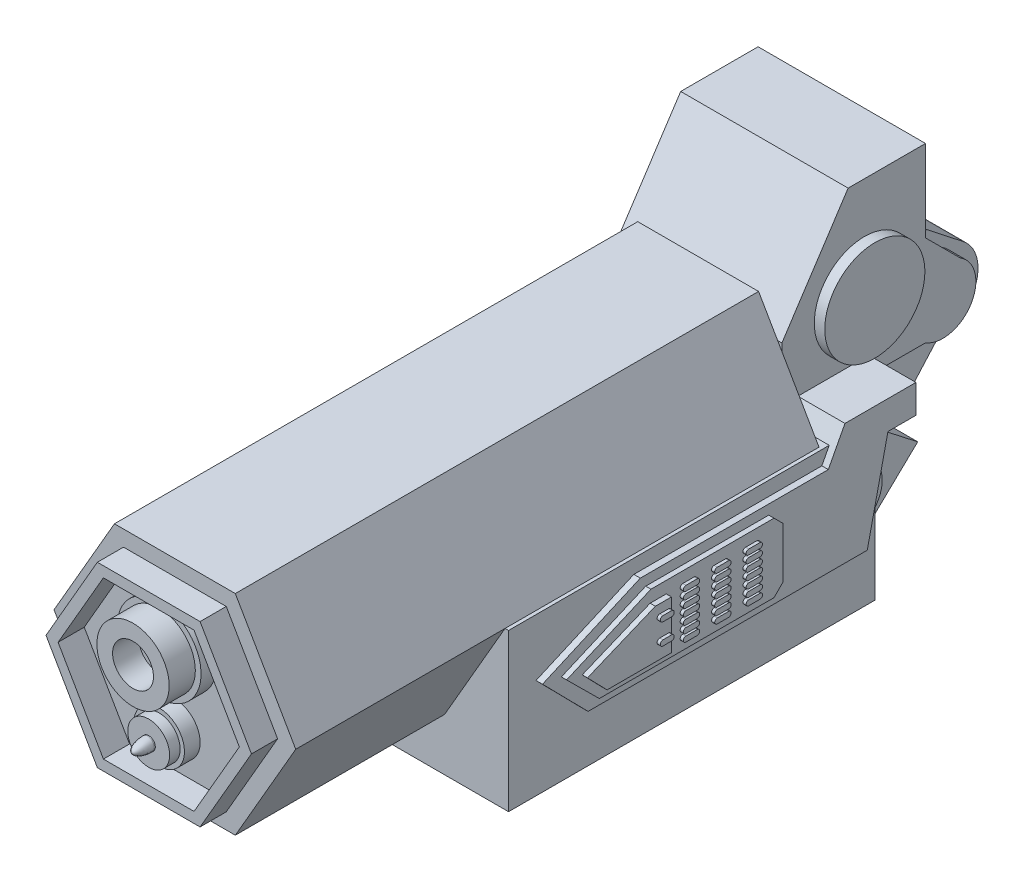
from build123d import *

# Parameters (mm, degrees)
BOSS_EXTRUDE1_DEPTH       = 127
EXTRUDE_THIN1_DEPTH       = 6.35
SKETCH3_R                 = 10.16
SKETCH3_R_2               = 6.130982387
BOSS_EXTRUDE2_DEPTH       = 3.81
SKETCH4_R                 = 8.771014966
SKETCH4_R_2               = 4.961014966
EXTRUDE_THIN2_DEPTH       = 6.35
SKETCH5_R                 = 5.08
BOSS_EXTRUDE3_DEPTH       = 2.54
SKETCH6_R                 = 1.599592482
BOSS_EXTRUDE4_DEPTH       = 0.254
DOME2_FACE_RADIUS         = 1.599592482
DOME2_HEIGHT              = 3.81
BOSS_EXTRUDE5_START       = -50.8
SKETCH7_W                 = 60.53039592
SKETCH7_H                 = 38.1
BOSS_EXTRUDE5_DEPTH       = 88.9
BOSS_EXTRUDE6_DEPTH       = 15.875
BOSS_EXTRUDE6_DEPTH_BACK  = 15.875
BOSS_EXTRUDE7_DEPTH       = 20.32
BOSS_EXTRUDE7_DEPTH_BACK  = 20.32
BOSS_EXTRUDE8_DEPTH       = 22.86
BOSS_EXTRUDE8_DEPTH_BACK  = 22.86
SKETCH10_R                = 12.155896329
BOSS_EXTRUDE9_DEPTH       = 12.7
BOSS_EXTRUDE9_DEPTH_BACK  = 12.7
BOSS_EXTRUDE10_DEPTH      = 15.24
BOSS_EXTRUDE10_DEPTH_BACK = 15.24
SKETCH12_R                = 7.651057211
BOSS_EXTRUDE11_DEPTH      = 1.27
BOSS_EXTRUDE12_DEPTH      = 2.54
FILLET1_R                 = 1.27
BOSS_EXTRUDE13_DEPTH      = 31.75
BOSS_EXTRUDE13_DEPTH_BACK = 31.75
BOSS_EXTRUDE14_DEPTH      = 1.27
BOSS_EXTRUDE15_DEPTH      = 1.27
BOSS_EXTRUDE16_DEPTH      = 0.762
BOSS_EXTRUDE17_DEPTH      = 0.762


with BuildPart() as part:
    # Sketch1 → Boss-Extrude1 (new body)
    with BuildSketch(Plane.XY):
        Polygon((14.664696837, 25.4), (-14.664696837, 25.4), (-29.329393675, 0), (-14.664696837, -25.4), (14.664696837, -25.4), (29.329393675, 0), align=None)
    extrude(amount=-BOSS_EXTRUDE1_DEPTH)

    # Sketch2 → Extrude-Thin1 (add)
    with BuildSketch(Plane.XY):
        Polygon((12.464992312, 21.59), (-12.464992312, 21.59), (-24.929984624, 0), (-12.464992312, -21.59), (12.464992312, -21.59), (24.929984624, 0), align=None)
        Polygon((10.998522628, 19.05), (-10.998522628, 19.05), (-21.997045256, 0), (-10.998522628, -19.05), (10.998522628, -19.05), (21.997045256, 0), align=None, mode=Mode.SUBTRACT)
    extrude(amount=EXTRUDE_THIN1_DEPTH)

    # Sketch3 → Boss-Extrude2 (add)
    with BuildSketch(Plane.XY):
        with Locations((0, 8.153143798)):
            Circle(SKETCH3_R)
        with Locations((0, -10.205567617)):
            Circle(SKETCH3_R_2)
    extrude(amount=BOSS_EXTRUDE2_DEPTH)

    # Sketch4 → Extrude-Thin2 (add)
    with BuildSketch(Plane.XY.offset(3.81)):
        with Locations((0, 8.153143798)):
            Circle(SKETCH4_R)
        with Locations((0, 8.153143798)):
            Circle(SKETCH4_R_2, mode=Mode.SUBTRACT)
    extrude(amount=EXTRUDE_THIN2_DEPTH)

    # Sketch5 → Boss-Extrude3 (add)
    with BuildSketch(Plane.XY.offset(3.81)):
        with Locations((0, -10.205567617)):
            Circle(SKETCH5_R)
    extrude(amount=BOSS_EXTRUDE3_DEPTH)

    # Sketch6 → Boss-Extrude4 (add)
    with BuildSketch(Plane.XY.offset(6.35)):
        with Locations((0, -10.205567617)):
            Circle(SKETCH6_R)
    extrude(amount=BOSS_EXTRUDE4_DEPTH)

    # Dome2: an elliptical dome of height H over a round flat face of radius A is half a spheroid: the quarter ellipse of half axes A and H revolved about the face's axis
    with BuildSketch(Plane((0, -10.205567617, 6.604), x_dir=(0, 1, 0), z_dir=(1, 0, 0)), mode=Mode.PRIVATE) as dome2_quarter:
        Ellipse(DOME2_FACE_RADIUS, DOME2_HEIGHT)
        Rectangle(DOME2_FACE_RADIUS, DOME2_HEIGHT, align=(Align.MIN, Align.MIN), mode=Mode.INTERSECT)
    revolve(dome2_quarter.sketch, axis=Axis((0, -10.205567617, 6.604), (0, 0, 1)))

    # Sketch7 → Boss-Extrude5 (add)
    with BuildSketch(Plane.XY.offset(BOSS_EXTRUDE5_START)):
        with Locations((-0.084337319, -19.05)):
            Rectangle(SKETCH7_W, SKETCH7_H)
    extrude(amount=-BOSS_EXTRUDE5_DEPTH)

    # Sketch8 → Boss-Extrude6 (add, two sides: drawn at the far end of the back side and taken through both)
    with BuildSketch(Plane(origin=(0, 0, 0), x_dir=(0, 0, -1), z_dir=(1, 0, 0)).offset(-BOSS_EXTRUDE6_DEPTH_BACK)):
        with BuildLine():
            Line((139.7, -19.05), (156.755020483, -19.05))
            Line((156.755020483, -19.05), (169.665919001, -4.499127949))
            ThreePointArc((169.665919001, -4.499127949), (178.53263058, 1.818354273), (175.456736667, 12.261918439))
            Line((175.456736667, 12.261918439), (166.505392697, 19.285280631))
            Line((166.505392697, 19.285280631), (139.7, 0))
            Line((139.7, 0), (139.7, -19.05))
        make_face()
    extrude(amount=BOSS_EXTRUDE6_DEPTH + BOSS_EXTRUDE6_DEPTH_BACK)

    # Sketch9 → Boss-Extrude7 (add, two sides: drawn at the far end of the back side and taken through both)
    with BuildSketch(Plane(origin=(0, 0, 0), x_dir=(0, 0, -1), z_dir=(1, 0, 0)).offset(-BOSS_EXTRUDE7_DEPTH_BACK)):
        with BuildLine():
            Line((127, 17.396330717), (143.0782889, 41.902791237))
            Line((143.0782889, 41.902791237), (161.860612656, 41.902791237))
            Line((161.860612656, 41.902791237), (161.860612656, 22.047191838))
            Line((161.860612656, 22.047191838), (170.267938528, 13.639865966))
            ThreePointArc((170.267938528, 13.639865966), (172.884208575, 2.616270047), (161.860612656, 0))
            Line((161.860612656, 0), (127, 0))
            Line((127, 0), (127, 17.396330717))
        make_face()
    extrude(amount=BOSS_EXTRUDE7_DEPTH + BOSS_EXTRUDE7_DEPTH_BACK)

    # Sketch10 → Boss-Extrude8 (add, two sides: drawn at the far end of the back side and taken through both)
    with BuildSketch(Plane(origin=(0, 0, 0), x_dir=(0, 0, -1), z_dir=(1, 0, 0)).offset(-BOSS_EXTRUDE8_DEPTH_BACK)):
        with Locations((147.013632925, 17.598159011)):
            Circle(SKETCH10_R)
    extrude(amount=BOSS_EXTRUDE8_DEPTH + BOSS_EXTRUDE8_DEPTH_BACK)

    # Sketch11 → Boss-Extrude9 (add, two sides: drawn at the far end of the back side and taken through both)
    with BuildSketch(Plane(origin=(0, 0, 0), x_dir=(0, 0, -1), z_dir=(1, 0, 0)).offset(-BOSS_EXTRUDE9_DEPTH_BACK)):
        Polygon((139.7, -19.05), (139.7, -38.1), (156.49423444, -38.1), (167.58474942, -27.479418003), (156.755020483, -19.05), align=None)
    extrude(amount=BOSS_EXTRUDE9_DEPTH + BOSS_EXTRUDE9_DEPTH_BACK)

    # Sketch12 → Boss-Extrude10 (add, two sides: drawn at the far end of the back side and taken through both)
    with BuildSketch(Plane(origin=(0, 0, 0), x_dir=(0, 0, -1), z_dir=(1, 0, 0)).offset(-BOSS_EXTRUDE10_DEPTH_BACK)):
        with Locations((148.781265781, -28.666165358)):
            Circle(SKETCH12_R)
    extrude(amount=BOSS_EXTRUDE10_DEPTH + BOSS_EXTRUDE10_DEPTH_BACK)

    # Sketch13 → Loft1 section 0
    with BuildSketch(Plane.XZ.offset(38.1)):
        with BuildLine():
            Line((-17.914717756, -147.013632925), (17.914717756, -147.013632925))
            Line((17.914717756, -147.013632925), (17.914717756, -64.843199806))
            Line((17.914717756, -64.843199806), (-17.914717756, -64.843199806))
            Line((-17.914717756, -64.843199806), (-17.914717756, -147.013632925))
        make_face()
    # Sketch14 → Loft1 section 1
    with BuildSketch(Plane.XZ.offset(57.15)):
        with BuildLine():
            Line((-8.55998081, -137.842026239), (8.55998081, -137.842026239))
            Line((8.55998081, -137.842026239), (8.55998081, -74.014806492))
            Line((8.55998081, -74.014806492), (-8.55998081, -74.014806492))
            Line((-8.55998081, -74.014806492), (-8.55998081, -137.842026239))
        make_face()
    loft()

    # Sketch15 → Boss-Extrude11 (add)
    with BuildSketch(Plane(origin=(0, 18.174623786, -37.749828901), x_dir=(1, 0, 0), z_dir=(0, -0.43379198440283934, 0.9010130488887755))):
        Polygon((-10.702917282, -62.457057482), (0, -82.541954153), (10.702917282, -62.457057482), align=None)
    extrude(amount=BOSS_EXTRUDE11_DEPTH)

    # Sketch16 → Boss-Extrude12 (add)
    with BuildSketch(Plane(origin=(0, 17.623707966, -36.605542329), x_dir=(1, 0, 0), z_dir=(0, -0.43379198440283934, 0.9010130488887755))):
        Polygon((-5.875334982, -62.457057482), (5.875334982, -62.457057482), (0, -79.447193144), align=None)
    extrude(amount=BOSS_EXTRUDE12_DEPTH)

    # Fillet1
    fillet1_edges = [part.edges().sort_by_distance(p)[0] for p in [
        (0, -56.472211896, -72.983723704),
        (0, -54.510165574, -69.924811326),
    ]]
    fillet(fillet1_edges, radius=FILLET1_R)

    # Sketch17 → Boss-Extrude13 (add, two sides: drawn at the far end of the back side and taken through both)
    with BuildSketch(Plane(origin=(0, 0, 0), x_dir=(0, 0, -1), z_dir=(1, 0, 0)).offset(-BOSS_EXTRUDE13_DEPTH_BACK)):
        Polygon((68.53064324, -25.093311277), (136.291150755, -25.093311277), (141.306761819, -2.648451762), (148.097884699, -2.648451762), (148.097884699, 4.263941169), (130.877537398, 4.263941169), (126.835575017, -3.415787355), (81.205195631, -3.415787355), (57.467347364, -13.846149218), align=None)
    extrude(amount=BOSS_EXTRUDE13_DEPTH + BOSS_EXTRUDE13_DEPTH_BACK)

    # Sketch18 → Boss-Extrude14 (add)
    with BuildSketch(Plane.ZY.offset(31.75)):
        Polygon((-112.381882763, -22.481176494), (-69.987954141, -22.481176494), (-62.048148254, -14.599325394), (-82.52155581, -5.76651242), (-112.381882763, -5.76651242), (-114.571210804, -7.955840461), (-114.571210804, -20.291848453), align=None)
    boss_extrude14 = extrude(amount=BOSS_EXTRUDE14_DEPTH)

    # Sketch19 → Boss-Extrude15 (add)
    with BuildSketch(Plane.ZY.offset(33.02)):
        Polygon((-86.231914515, -20.33826297), (-70.601786264, -20.33826297), (-65.844790709, -15.435645103), (-82.324382452, -8.615666782), (-86.231914515, -8.615666782), align=None)
    boss_extrude15 = extrude(amount=BOSS_EXTRUDE15_DEPTH)

    # Sketch20 → Boss-Extrude16 (add)
    with BuildSketch(Plane.ZY.offset(34.29)):
        with BuildLine():
            Line((-85.490728255, -10.751958985), (-83.395896468, -10.751958985))
            ThreePointArc((-83.395896468, -10.751958985), (-82.745229018, -11.402626434), (-83.395896468, -12.053293883))
            Line((-83.395896468, -12.053293883), (-85.490728255, -12.053293883))
            ThreePointArc((-85.490728255, -12.053293883), (-86.141395704, -11.402626434), (-85.490728255, -10.751958985))
        make_face()
        with BuildLine():
            Line((-85.490728255, -15.831958985), (-83.395896468, -15.831958985))
            ThreePointArc((-83.395896468, -15.831958985), (-82.745229018, -16.482626434), (-83.395896468, -17.133293883))
            Line((-83.395896468, -17.133293883), (-85.490728255, -17.133293883))
            ThreePointArc((-85.490728255, -17.133293883), (-86.141395704, -16.482626434), (-85.490728255, -15.831958985))
        make_face()
    boss_extrude16 = extrude(amount=BOSS_EXTRUDE16_DEPTH)

    # Sketch21 → Boss-Extrude17 (add)
    with BuildSketch(Plane.ZY.offset(33.02)):
        with BuildLine():
            Line((-108.213177558, -8.432206471), (-105.483016436, -8.432206471))
            ThreePointArc((-105.483016436, -8.432206471), (-104.854506677, -9.06071623), (-105.483016436, -9.689225989))
            Line((-105.483016436, -9.689225989), (-108.213177558, -9.689225989))
            ThreePointArc((-108.213177558, -9.689225989), (-108.841687317, -9.06071623), (-108.213177558, -8.432206471))
        make_face()
        with BuildLine():
            Line((-100.593177558, -8.432206471), (-97.863016436, -8.432206471))
            ThreePointArc((-97.863016436, -8.432206471), (-97.234506677, -9.06071623), (-97.863016436, -9.689225989))
            Line((-97.863016436, -9.689225989), (-100.593177558, -9.689225989))
            ThreePointArc((-100.593177558, -9.689225989), (-101.221687317, -9.06071623), (-100.593177558, -8.432206471))
        make_face()
        with BuildLine():
            Line((-92.973177558, -8.432206471), (-90.243016436, -8.432206471))
            ThreePointArc((-90.243016436, -8.432206471), (-89.614506677, -9.06071623), (-90.243016436, -9.689225989))
            Line((-90.243016436, -9.689225989), (-92.973177558, -9.689225989))
            ThreePointArc((-92.973177558, -9.689225989), (-93.601687317, -9.06071623), (-92.973177558, -8.432206471))
        make_face()
        with BuildLine():
            Line((-108.213177558, -10.210206471), (-105.483016436, -10.210206471))
            ThreePointArc((-105.483016436, -10.210206471), (-104.854506677, -10.83871623), (-105.483016436, -11.467225989))
            Line((-105.483016436, -11.467225989), (-108.213177558, -11.467225989))
            ThreePointArc((-108.213177558, -11.467225989), (-108.841687317, -10.83871623), (-108.213177558, -10.210206471))
        make_face()
        with BuildLine():
            Line((-100.593177558, -10.210206471), (-97.863016436, -10.210206471))
            ThreePointArc((-97.863016436, -10.210206471), (-97.234506677, -10.83871623), (-97.863016436, -11.467225989))
            Line((-97.863016436, -11.467225989), (-100.593177558, -11.467225989))
            ThreePointArc((-100.593177558, -11.467225989), (-101.221687317, -10.83871623), (-100.593177558, -10.210206471))
        make_face()
        with BuildLine():
            Line((-92.973177558, -10.210206471), (-90.243016436, -10.210206471))
            ThreePointArc((-90.243016436, -10.210206471), (-89.614506677, -10.83871623), (-90.243016436, -11.467225989))
            Line((-90.243016436, -11.467225989), (-92.973177558, -11.467225989))
            ThreePointArc((-92.973177558, -11.467225989), (-93.601687317, -10.83871623), (-92.973177558, -10.210206471))
        make_face()
        with BuildLine():
            Line((-108.213177558, -11.988206471), (-105.483016436, -11.988206471))
            ThreePointArc((-105.483016436, -11.988206471), (-104.854506677, -12.61671623), (-105.483016436, -13.245225989))
            Line((-105.483016436, -13.245225989), (-108.213177558, -13.245225989))
            ThreePointArc((-108.213177558, -13.245225989), (-108.841687317, -12.61671623), (-108.213177558, -11.988206471))
        make_face()
        with BuildLine():
            Line((-100.593177558, -11.988206471), (-97.863016436, -11.988206471))
            ThreePointArc((-97.863016436, -11.988206471), (-97.234506677, -12.61671623), (-97.863016436, -13.245225989))
            Line((-97.863016436, -13.245225989), (-100.593177558, -13.245225989))
            ThreePointArc((-100.593177558, -13.245225989), (-101.221687317, -12.61671623), (-100.593177558, -11.988206471))
        make_face()
        with BuildLine():
            Line((-92.973177558, -11.988206471), (-90.243016436, -11.988206471))
            ThreePointArc((-90.243016436, -11.988206471), (-89.614506677, -12.61671623), (-90.243016436, -13.245225989))
            Line((-90.243016436, -13.245225989), (-92.973177558, -13.245225989))
            ThreePointArc((-92.973177558, -13.245225989), (-93.601687317, -12.61671623), (-92.973177558, -11.988206471))
        make_face()
        with BuildLine():
            Line((-108.213177558, -13.766206471), (-105.483016436, -13.766206471))
            ThreePointArc((-105.483016436, -13.766206471), (-104.854506677, -14.39471623), (-105.483016436, -15.023225989))
            Line((-105.483016436, -15.023225989), (-108.213177558, -15.023225989))
            ThreePointArc((-108.213177558, -15.023225989), (-108.841687317, -14.39471623), (-108.213177558, -13.766206471))
        make_face()
        with BuildLine():
            Line((-100.593177558, -13.766206471), (-97.863016436, -13.766206471))
            ThreePointArc((-97.863016436, -13.766206471), (-97.234506677, -14.39471623), (-97.863016436, -15.023225989))
            Line((-97.863016436, -15.023225989), (-100.593177558, -15.023225989))
            ThreePointArc((-100.593177558, -15.023225989), (-101.221687317, -14.39471623), (-100.593177558, -13.766206471))
        make_face()
        with BuildLine():
            Line((-92.973177558, -13.766206471), (-90.243016436, -13.766206471))
            ThreePointArc((-90.243016436, -13.766206471), (-89.614506677, -14.39471623), (-90.243016436, -15.023225989))
            Line((-90.243016436, -15.023225989), (-92.973177558, -15.023225989))
            ThreePointArc((-92.973177558, -15.023225989), (-93.601687317, -14.39471623), (-92.973177558, -13.766206471))
        make_face()
        with BuildLine():
            Line((-108.213177558, -15.544206471), (-105.483016436, -15.544206471))
            ThreePointArc((-105.483016436, -15.544206471), (-104.854506677, -16.17271623), (-105.483016436, -16.801225989))
            Line((-105.483016436, -16.801225989), (-108.213177558, -16.801225989))
            ThreePointArc((-108.213177558, -16.801225989), (-108.841687317, -16.17271623), (-108.213177558, -15.544206471))
        make_face()
        with BuildLine():
            Line((-100.593177558, -15.544206471), (-97.863016436, -15.544206471))
            ThreePointArc((-97.863016436, -15.544206471), (-97.234506677, -16.17271623), (-97.863016436, -16.801225989))
            Line((-97.863016436, -16.801225989), (-100.593177558, -16.801225989))
            ThreePointArc((-100.593177558, -16.801225989), (-101.221687317, -16.17271623), (-100.593177558, -15.544206471))
        make_face()
        with BuildLine():
            Line((-92.973177558, -15.544206471), (-90.243016436, -15.544206471))
            ThreePointArc((-90.243016436, -15.544206471), (-89.614506677, -16.17271623), (-90.243016436, -16.801225989))
            Line((-90.243016436, -16.801225989), (-92.973177558, -16.801225989))
            ThreePointArc((-92.973177558, -16.801225989), (-93.601687317, -16.17271623), (-92.973177558, -15.544206471))
        make_face()
        with BuildLine():
            Line((-108.213177558, -17.322206471), (-105.483016436, -17.322206471))
            ThreePointArc((-105.483016436, -17.322206471), (-104.854506677, -17.95071623), (-105.483016436, -18.579225989))
            Line((-105.483016436, -18.579225989), (-108.213177558, -18.579225989))
            ThreePointArc((-108.213177558, -18.579225989), (-108.841687317, -17.95071623), (-108.213177558, -17.322206471))
        make_face()
        with BuildLine():
            Line((-100.593177558, -17.322206471), (-97.863016436, -17.322206471))
            ThreePointArc((-97.863016436, -17.322206471), (-97.234506677, -17.95071623), (-97.863016436, -18.579225989))
            Line((-97.863016436, -18.579225989), (-100.593177558, -18.579225989))
            ThreePointArc((-100.593177558, -18.579225989), (-101.221687317, -17.95071623), (-100.593177558, -17.322206471))
        make_face()
        with BuildLine():
            Line((-92.973177558, -17.322206471), (-90.243016436, -17.322206471))
            ThreePointArc((-90.243016436, -17.322206471), (-89.614506677, -17.95071623), (-90.243016436, -18.579225989))
            Line((-90.243016436, -18.579225989), (-92.973177558, -18.579225989))
            ThreePointArc((-92.973177558, -18.579225989), (-93.601687317, -17.95071623), (-92.973177558, -17.322206471))
        make_face()
        with BuildLine():
            Line((-108.213177558, -19.100206471), (-105.483016436, -19.100206471))
            ThreePointArc((-105.483016436, -19.100206471), (-104.854506677, -19.72871623), (-105.483016436, -20.357225989))
            Line((-105.483016436, -20.357225989), (-108.213177558, -20.357225989))
            ThreePointArc((-108.213177558, -20.357225989), (-108.841687317, -19.72871623), (-108.213177558, -19.100206471))
        make_face()
        with BuildLine():
            Line((-100.593177558, -19.100206471), (-97.863016436, -19.100206471))
            ThreePointArc((-97.863016436, -19.100206471), (-97.234506677, -19.72871623), (-97.863016436, -20.357225989))
            Line((-97.863016436, -20.357225989), (-100.593177558, -20.357225989))
            ThreePointArc((-100.593177558, -20.357225989), (-101.221687317, -19.72871623), (-100.593177558, -19.100206471))
        make_face()
        with BuildLine():
            Line((-92.973177558, -19.100206471), (-90.243016436, -19.100206471))
            ThreePointArc((-90.243016436, -19.100206471), (-89.614506677, -19.72871623), (-90.243016436, -20.357225989))
            Line((-90.243016436, -20.357225989), (-92.973177558, -20.357225989))
            ThreePointArc((-92.973177558, -20.357225989), (-93.601687317, -19.72871623), (-92.973177558, -19.100206471))
        make_face()
    boss_extrude17 = extrude(amount=BOSS_EXTRUDE17_DEPTH)

    # Mirror1: Boss-Extrude14, Boss-Extrude15, Boss-Extrude16, Boss-Extrude17 across plane
    add(boss_extrude14.mirror(Plane(origin=(0, 0, 0), x_dir=(0, 0, 1), z_dir=(1, 0, 0))))
    add(boss_extrude15.mirror(Plane(origin=(0, 0, 0), x_dir=(0, 0, 1), z_dir=(1, 0, 0))))
    add(boss_extrude16.mirror(Plane(origin=(0, 0, 0), x_dir=(0, 0, 1), z_dir=(1, 0, 0))))
    add(boss_extrude17.mirror(Plane(origin=(0, 0, 0), x_dir=(0, 0, 1), z_dir=(1, 0, 0))))


solid = part.part
